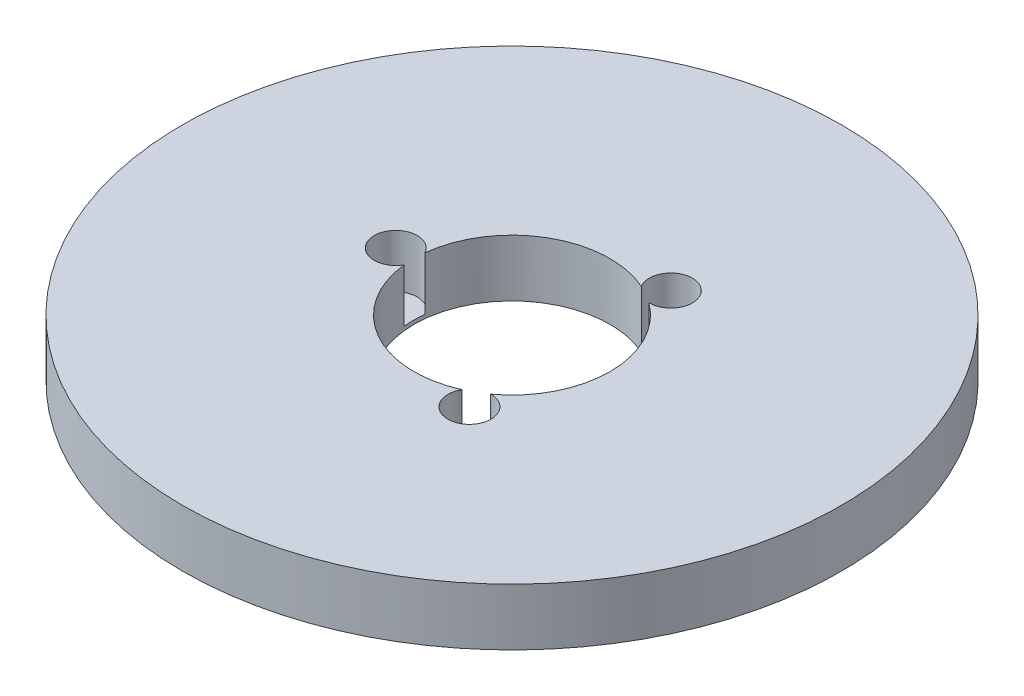
from build123d import *

# Parameters (mm, degrees)
SKETCH1_R           = 92.5
BOSS_EXTRUDE1_DEPTH = 16
SKETCH2_R           = 27.5
CUT_EXTRUDE1_DEPTH  = 132.789605053
SKETCH3_R           = 6.047272506
CUT_EXTRUDE2_DEPTH  = 14.926051379
CIRPATTERN1_COUNT   = 3


with BuildPart() as part:
    # Sketch1 → Boss-Extrude1 (new body)
    with BuildSketch(Plane(origin=(0, 0, 0), x_dir=(1, 0, 0), z_dir=(0, 1, 0))):
        Circle(SKETCH1_R)
    extrude(amount=BOSS_EXTRUDE1_DEPTH)

    # Sketch2 → Cut-Extrude1 (cut, through all)
    with BuildSketch(Plane(origin=(0, 0, 0), x_dir=(1, 0, 0), z_dir=(0, 1, 0))):
        Circle(SKETCH2_R)
    extrude(amount=CUT_EXTRUDE1_DEPTH, mode=Mode.SUBTRACT)

    # Sketch3 → Cut-Extrude2 (cut)
    with BuildSketch(Plane(origin=(0, 16, 0), x_dir=(1, 0, 0), z_dir=(0, 1, 0))):
        with Locations((-32.634958459, 0)):
            Circle(SKETCH3_R)
    cut_extrude2 = extrude(amount=-CUT_EXTRUDE2_DEPTH, mode=Mode.SUBTRACT)

    # CirPattern1: Cut-Extrude2 ×3 about axis
    cirpattern1_axis = Axis((0, 0, 0), (0, 1, 0))
    for i in range(1, CIRPATTERN1_COUNT):
        add(cut_extrude2.rotate(cirpattern1_axis, i * 360 / CIRPATTERN1_COUNT), mode=Mode.SUBTRACT)


solid = part.part
